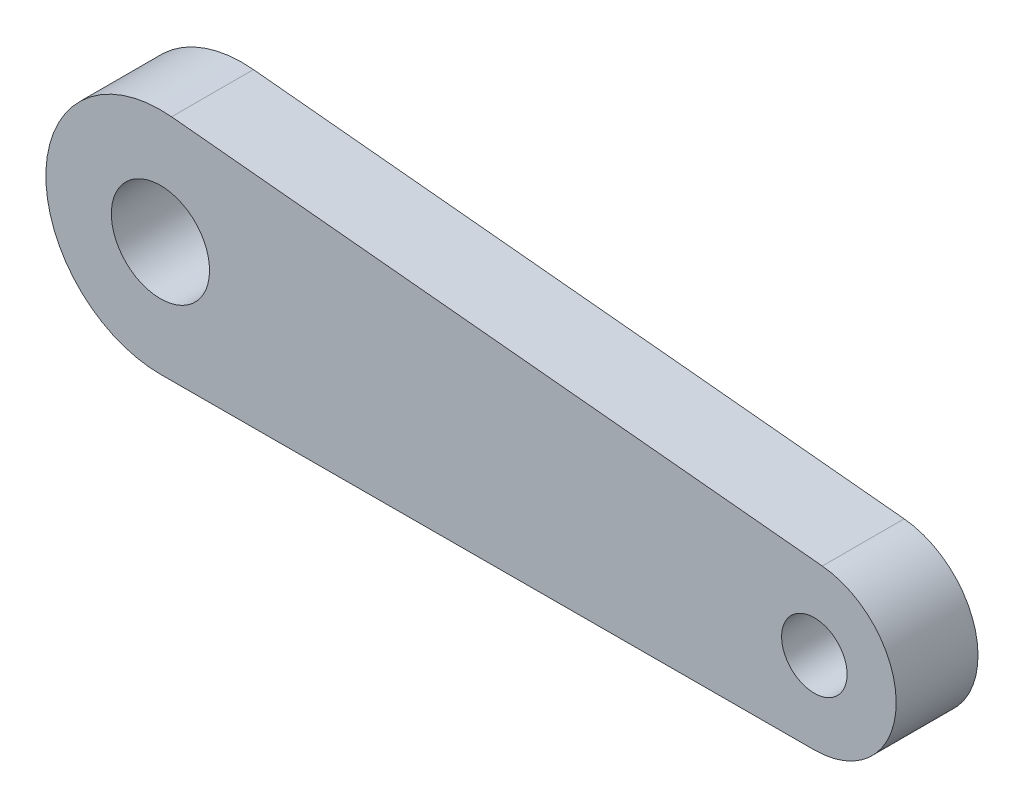
from build123d import *

# Parameters (mm, degrees)
BOSS_EXTRUDE1_START = 10
SKETCH1_R           = 3
SKETCH1_R_2         = 2
BOSS_EXTRUDE1_DEPTH = 5


with BuildPart() as part:
    # Sketch1 → Boss-Extrude1 (new body)
    with BuildSketch(Plane.XY.offset(BOSS_EXTRUDE1_START)):
        with BuildLine():
            Line((-59.318176562, 16.966714922), (-19.558170399, 13.075454204))
            ThreePointArc((-19.558170399, 13.075454204), (-15.050835534, 7.861632918), (-20.032768722, 3.099244682))
            Line((-20.032768722, 3.099244682), (-59.982614213, 3.00002159))
            ThreePointArc((-59.982614213, 3.00002159), (-66.99209225, 10.332634879), (-59.318176562, 16.966714922))
        make_face()
        with Locations((-60, 10)):
            Circle(SKETCH1_R, mode=Mode.SUBTRACT)
        with Locations((-20.045187141, 8.09922926)):
            Circle(SKETCH1_R_2, mode=Mode.SUBTRACT)
    extrude(amount=BOSS_EXTRUDE1_DEPTH)


solid = part.part
